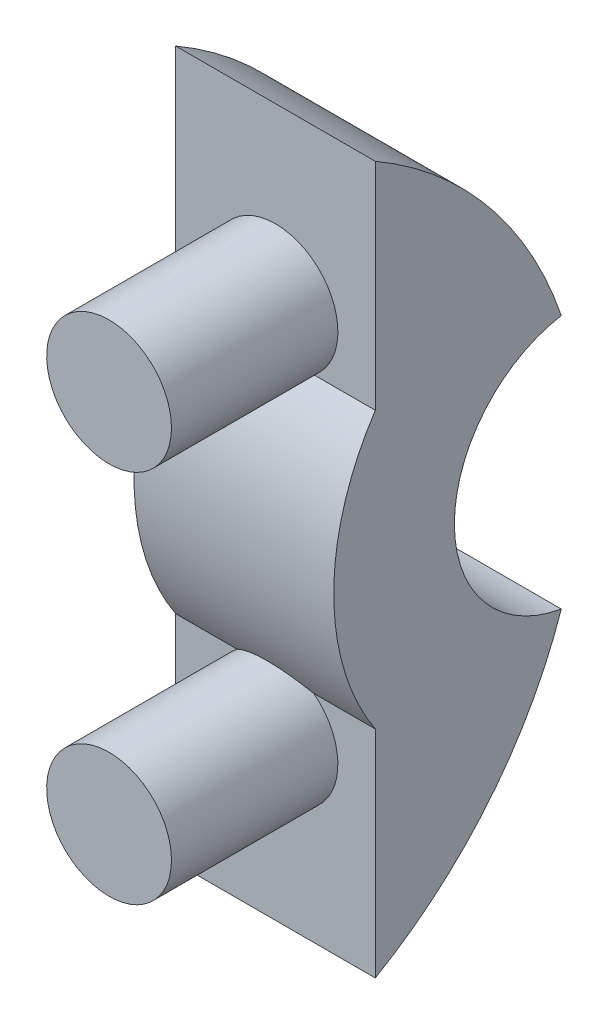
from build123d import *

# Parameters (mm, degrees)
SKETCH_1_W          = 4.8
SKETCH_1_H          = 17
EXTRUDE_1_DEPTH     = 5
SKETCH_2_R          = 3.1
CUT_EXTRUDE_1_DEPTH = 19.358649188
EXTRUDE_2_DEPTH     = 4.8
FILLET_1_R          = 10
SKETCH_4_R          = 1.5
EXTRUDE_3_DEPTH     = 4


with BuildPart() as part:
    # 草图1 → 凸台-拉伸1 (new body)
    with BuildSketch(Plane.XY):
        with Locations((2.4, 8.5)):
            Rectangle(SKETCH_1_W, SKETCH_1_H)
    extrude(amount=EXTRUDE_1_DEPTH)

    # 草图2 → 切除-拉伸1 (cut, through all)
    with BuildSketch(Plane(origin=(4.8, 0, 0), x_dir=(0, 0, -1), z_dir=(1, 0, 0))):
        with Locations((0, 8.5)):
            Circle(SKETCH_2_R)
    extrude(amount=-CUT_EXTRUDE_1_DEPTH, mode=Mode.SUBTRACT)

    # 草图3 → 凸台-拉伸2 (add)
    with BuildSketch(Plane(origin=(4.8, 0, 0), x_dir=(0, 0, -1), z_dir=(1, 0, 0))):
        with BuildLine():
            Line((-5, 11.81662479), (-5, 5.18337521))
            ThreePointArc((-5, 5.18337521), (-6, 8.5), (-5, 11.81662479))
        make_face()
    extrude(amount=-EXTRUDE_2_DEPTH)

    # 圆角1
    # the kernel refuses this fillet: 10 mm, written as the material it takes off along each edge
    with BuildSketch(Plane(origin=(-21.650635095, 0, 0), x_dir=(0, 0, 1), z_dir=(1, 0, 0))) as fillet_1_piece_1:
        with BuildLine():
            CenterArc((10, -8.660254038), FILLET_1_R, 120, 60)
            Line((0, -8.660254038), (0, 0))
            Line((0, 0), (5, 0))
        make_face()
    extrude(amount=48.101270189, mode=Mode.SUBTRACT)
    with BuildSketch(Plane(origin=(26.450635095, 17, 0), x_dir=(0, -1, 0), z_dir=(-1, 0, 0))) as fillet_1_piece_2:
        with BuildLine():
            CenterArc((8.660254038, 10), FILLET_1_R, 210, 60)
            Line((0, 5), (0, 0))
            Line((0, 0), (8.660254038, 0))
        make_face()
    extrude(amount=48.101270189, mode=Mode.SUBTRACT)

    # 草图4 → 凸台-拉伸3 (add)
    with BuildSketch(Plane.XY.offset(5)):
        with Locations(Location((2.4, 13, 0), (0, 0, 232.08440029))):
            Circle(SKETCH_4_R)
        with Locations(Location((2.4, 4, 0), (0, 0, 127.91559971))):
            Circle(SKETCH_4_R)
    extrude(amount=EXTRUDE_3_DEPTH)


solid = part.part
